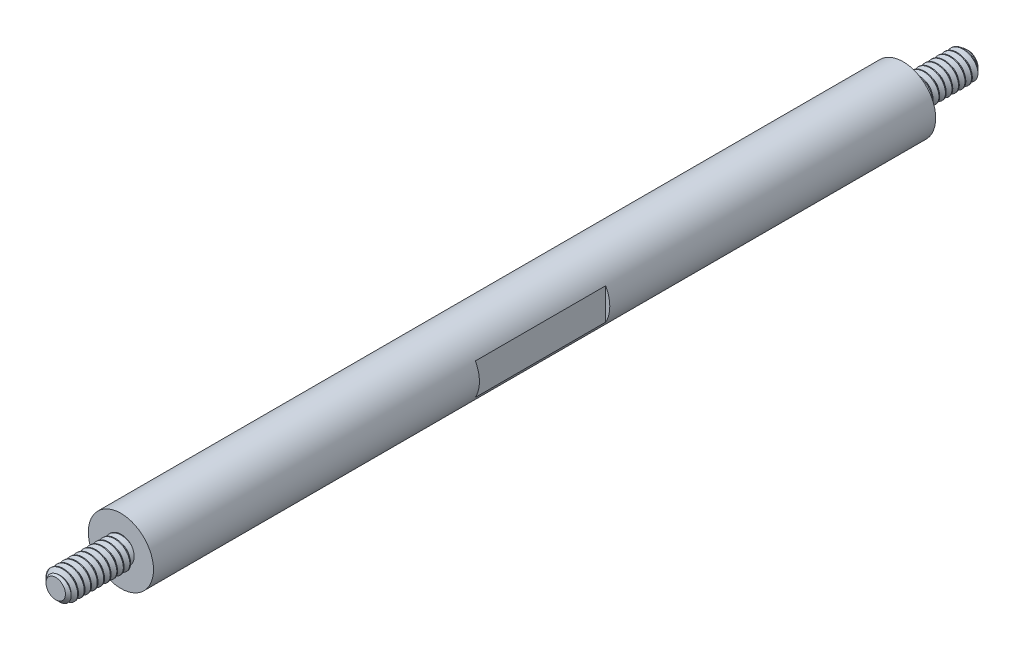
from build123d import *

# Parameters (mm, degrees)
SKETCH1_R          = 3.175
EXTRUDE1_DEPTH     = 76.2
SKETCH2_R          = 1.4224
EXTRUDE2_DEPTH     = 6.35
CHAMFER1_SIZE      = 0.47625
CUT_SWEEP1_PITCH   = 0.635
CIRPATTERN1_COUNT  = 2
SKETCH5_W          = 3.952875
SKETCH5_H          = 3.207902434
SKETCH5_W_2        = 6.4008
CUT_EXTRUDE1_DEPTH = 6.35


with BuildPart() as part:
    # Sketch1 → Extrude1 (new body)
    with BuildSketch(Plane.XY):
        Circle(SKETCH1_R)
    extrude(amount=-EXTRUDE1_DEPTH)


with BuildPart() as body_2:
    # Sketch2 → Extrude2 (new body)
    with BuildSketch(Plane.XY):
        Circle(SKETCH2_R)
    extrude(amount=EXTRUDE2_DEPTH)

    # Chamfer1
    chamfer1_edges = [body_2.edges().sort_by_distance(p)[0] for p in [
        (-1.4224, 0, 6.35),
    ]]
    chamfer(chamfer1_edges, length=CHAMFER1_SIZE)

    # Cut-Sweep1: the profile of Sketch4 screwed along a right-hand helix of 11 turns, 6 arcs to a turn; built about Z, then put on its axis
    cut_sweep1_z = Axis((0, 0, 0), (0, 0, 1))
    cut_sweep1_corners = [(1.456770383, 0, 0.01984375), (1.456770383, 0, -0.57546875), (1.009955401, 0, -0.3175), (1.009955401, 0, -0.238125)]
    with BuildLine(mode=Mode.PRIVATE) as cut_sweep1_profile:
        Line(cut_sweep1_corners[0], cut_sweep1_corners[1])
        Line(cut_sweep1_corners[1], cut_sweep1_corners[2])
        Line(cut_sweep1_corners[2], cut_sweep1_corners[3])
        Line(cut_sweep1_corners[3], cut_sweep1_corners[0])
    cut_sweep1_cap = Face(cut_sweep1_profile.wire())
    cut_sweep1_turn_angles = [0, 30, 60, 90, 120, 150, 180, 210, 240, 270, 300, 330, 360]
    cut_sweep1_turn_weights = [1, 0.8660254037844387, 1, 0.8660254037844387, 1, 0.8660254037844387, 1, 0.8660254037844387, 1, 0.8660254037844387, 1, 0.8660254037844387, 1]
    cut_sweep1_turn_rails = [Edge.make_bspline([Vector(p[0], p[1], 0).rotate(cut_sweep1_z, cut_sweep1_turn_angles[k]) / cut_sweep1_turn_weights[k] + Vector(0, 0, p[2] + CUT_SWEEP1_PITCH * cut_sweep1_turn_angles[k] / 360) for k in range(13)], [0, 0, 0, 1, 1, 2, 2, 3, 3, 4, 4, 5, 5, 6, 6, 6], 2, cut_sweep1_turn_weights) for p in cut_sweep1_corners]
    cut_sweep1_turn_sides = [Face.make_surface_from_curves(cut_sweep1_turn_rails[p[0]], cut_sweep1_turn_rails[p[1]]) for p in [(0, 1), (1, 2), (2, 3), (3, 0)]]
    cut_sweep1 = Plane(origin=(0, 0, 0), x_dir=(0, 1, 0), z_dir=(0, 0, 1)) * Solid(Shell([*[p.moved(Location((0, 0, CUT_SWEEP1_PITCH * i))) for i in range(11) for p in cut_sweep1_turn_sides], cut_sweep1_cap, cut_sweep1_cap.rotate(cut_sweep1_z, 3960).moved(Location((0, 0, CUT_SWEEP1_PITCH * 3960 / 360)))]))
    add(cut_sweep1, mode=Mode.SUBTRACT)


with BuildPart() as cirpattern1_1:
    # CirPattern1: pattern copy
    add(body_2.part.rotate(Axis((0, 3.4925, -38.1), (0, -1, 0)), 1 * 360 / CIRPATTERN1_COUNT))

    # Combine1: union part, body 2
    add(part.part)
    add(body_2.part)

    # Sketch5 → Cut-Extrude1 (cut, symmetric)
    with BuildSketch(Plane.XY.offset(-38.1)):
        with Locations((-4.7545625, 0)):
            Rectangle(SKETCH5_W, SKETCH5_H)
        with Locations((5.978525, 0)):
            Rectangle(SKETCH5_W_2, SKETCH5_H)
    extrude(amount=CUT_EXTRUDE1_DEPTH, both=True, mode=Mode.SUBTRACT)


solid = cirpattern1_1.part
